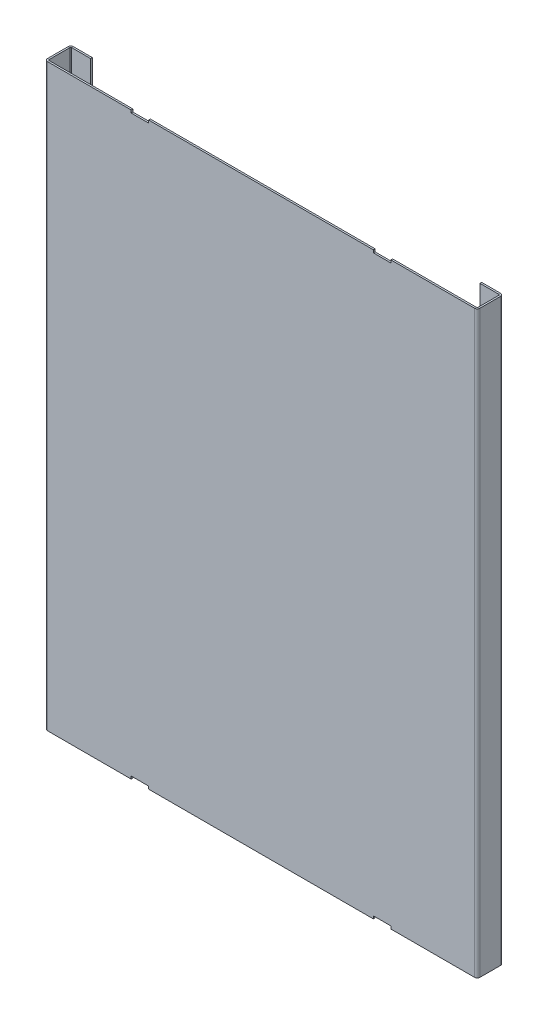
from build123d import *

# Parameters (mm, degrees)
SM_BASE_FLANGE_1_DEPTH = 670
SKETCH_2_W             = 20.2
SKETCH_2_H             = 3.1
CUT_EXTRUDE_1_DEPTH    = 10
SKETCH_4_W             = 20.2
SKETCH_4_H             = 3.1
CUT_EXTRUDE_3_DEPTH    = 10


# Sheet-metal steps are written as plain solids
with BuildPart() as part:
    # Sketch 1 → Базовая кромка1 (new body)
    with BuildSketch(Plane(origin=(0, 0, 0), x_dir=(1, 0, 0), z_dir=(0, 1, 0))):
        with BuildLine():
            Line((-31.146330545, 0), (-53.046330545, 0))
            ThreePointArc((-53.046330545, 0), (-55.238361567, -0.907968978), (-56.146330545, -3.1))
            Line((-56.146330545, -3.1), (-56.146330545, -26.9))
            ThreePointArc((-56.146330545, -26.9), (-55.238361567, -29.092031022), (-53.046330545, -30))
            Line((-53.046330545, -30), (440.753669455, -30))
            ThreePointArc((440.753669455, -30), (442.945700477, -29.092031022), (443.853669455, -26.9))
            Line((443.853669455, -26.9), (443.853669455, -3.1))
            ThreePointArc((443.853669455, -3.1), (442.945700477, -0.907968978), (440.753669455, 0))
            Line((440.753669455, 0), (418.853669455, 0))
            Line((418.853669455, 0), (418.853669455, -2))
            Line((418.853669455, -2), (440.753669455, -2))
            ThreePointArc((440.753669455, -2), (441.531486914, -2.322182541), (441.853669455, -3.1))
            Line((441.853669455, -3.1), (441.853669455, -26.9))
            ThreePointArc((441.853669455, -26.9), (441.531486914, -27.677817459), (440.753669455, -28))
            Line((440.753669455, -28), (-53.046330545, -28))
            ThreePointArc((-53.046330545, -28), (-53.824148004, -27.677817459), (-54.146330545, -26.9))
            Line((-54.146330545, -26.9), (-54.146330545, -3.1))
            ThreePointArc((-54.146330545, -3.1), (-53.824148004, -2.322182541), (-53.046330545, -2))
            Line((-53.046330545, -2), (-31.146330545, -2))
            Line((-31.146330545, -2), (-31.146330545, 0))
        make_face()
    extrude(amount=SM_BASE_FLANGE_1_DEPTH)

    # Эскиз2 → Вырез-Вытянуть1 (cut)
    with BuildSketch(Plane.XY.offset(30)):
        with Locations((53.853669455, 1.55)):
            Rectangle(SKETCH_2_W, SKETCH_2_H)
        with Locations((333.853669455, 1.55)):
            Rectangle(SKETCH_2_W, SKETCH_2_H)
    extrude(amount=-CUT_EXTRUDE_1_DEPTH, mode=Mode.SUBTRACT)

    # Эскиз4 → Вырез-Вытянуть3 (cut)
    with BuildSketch(Plane.XY.offset(30)):
        with Locations((53.853669455, 668.45)):
            Rectangle(SKETCH_4_W, SKETCH_4_H)
        with Locations((333.853669455, 668.45)):
            Rectangle(SKETCH_4_W, SKETCH_4_H)
    extrude(amount=-CUT_EXTRUDE_3_DEPTH, mode=Mode.SUBTRACT)


solid = part.part
